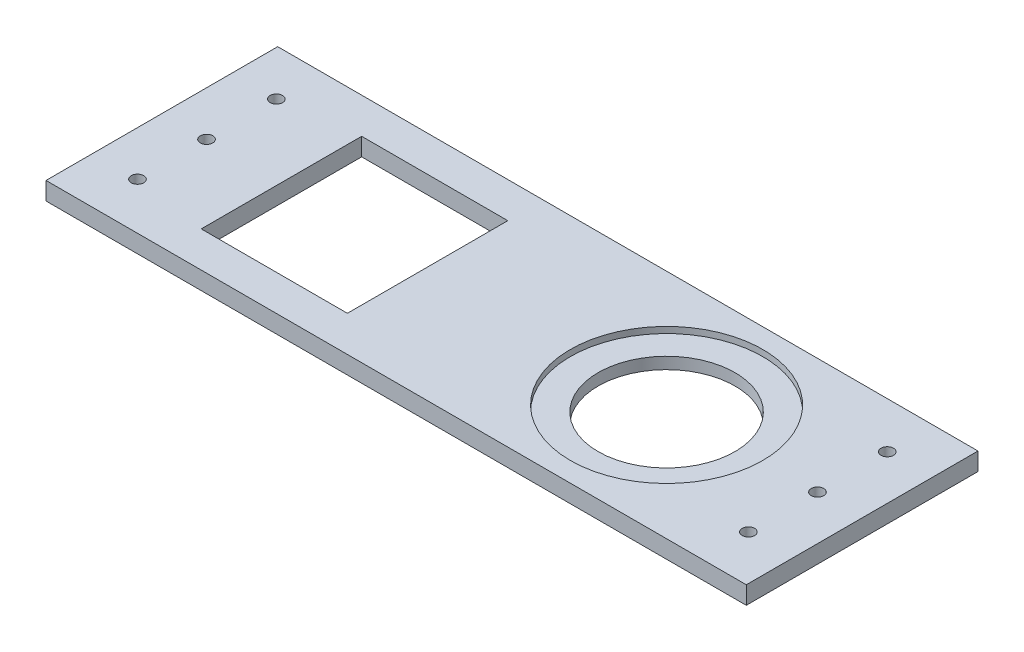
from build123d import *

# Parameters (mm, degrees)
SKETCH2_W               = 196.45
SKETCH2_H               = 151.7
BOSS_EXTRUDE1_DEPTH     = 5
CUT_EXTRUDE2_DEPTH      = 15
CUT_EXTRUDE2_DEPTH_BACK = 22
SKETCH3_R               = 19.2
SKETCH3_W               = 41
SKETCH3_H               = 45
SKETCH4_R               = 26.99
CUT_EXTRUDE3_DEPTH      = 1.74
SKETCH9_W               = 196.45
SKETCH9_H               = 44.2
SKETCH9_H_2             = 42.5
CUT_EXTRUDE7_DEPTH      = 20
SKETCH10_R              = 1.75
CUT_EXTRUDE8_DEPTH      = 71


with BuildPart() as part:
    # Sketch2 → Boss-Extrude1 (new body)
    with BuildSketch(Plane(origin=(0, 0, 0), x_dir=(1, 0, 0), z_dir=(0, 1, 0))):
        with Locations((-1.775, 0.85)):
            Rectangle(SKETCH2_W, SKETCH2_H)
    extrude(amount=BOSS_EXTRUDE1_DEPTH)

    # Sketch3 → Cut-Extrude2 (cut, two sides: drawn at the far end of the back side and taken through both)
    with BuildSketch(Plane(origin=(0, 0, 0), x_dir=(1, 0, 0), z_dir=(0, 1, 0)).offset(-CUT_EXTRUDE2_DEPTH_BACK)):
        with Locations((41.585, 0)):
            Circle(SKETCH3_R)
        with Locations((-45.952707493, 0)):
            Rectangle(SKETCH3_W, SKETCH3_H)
    extrude(amount=CUT_EXTRUDE2_DEPTH + CUT_EXTRUDE2_DEPTH_BACK, mode=Mode.SUBTRACT)

    # Sketch4 → Cut-Extrude3 (cut)
    with BuildSketch(Plane(origin=(0, 5, 0), x_dir=(1, 0, 0), z_dir=(0, 1, 0))):
        with Locations((41.585, 0)):
            Circle(SKETCH4_R)
    extrude(amount=-CUT_EXTRUDE3_DEPTH, mode=Mode.SUBTRACT)

    # Sketch9 → Cut-Extrude7 (cut)
    with BuildSketch(Plane(origin=(0, 5, 0), x_dir=(1, 0, 0), z_dir=(0, 1, 0))):
        with Locations((-1.775, 54.6)):
            Rectangle(SKETCH9_W, SKETCH9_H)
        with Locations((-1.775, -53.75)):
            Rectangle(SKETCH9_W, SKETCH9_H_2)
    extrude(amount=-CUT_EXTRUDE7_DEPTH, mode=Mode.SUBTRACT)

    # Sketch10 → Cut-Extrude8 (cut)
    with BuildSketch(Plane(origin=(-19.622722173, -51.76654099, -93.279928148), x_dir=(1, 0, 0), z_dir=(0, 1, 0))):
        with Locations((-67.844805312, -93.279928148)):
            Circle(SKETCH10_R)
        with Locations((-67.844805312, -112.647304941)):
            Circle(SKETCH10_R)
        with Locations((-67.844805312, -73.696156084)):
            Circle(SKETCH10_R)
        with Locations((103.540249658, -73.696156084)):
            Circle(SKETCH10_R)
        with Locations((103.540249658, -93.279928148)):
            Circle(SKETCH10_R)
        with Locations((103.540249658, -112.647304941)):
            Circle(SKETCH10_R)
    extrude(amount=CUT_EXTRUDE8_DEPTH, mode=Mode.SUBTRACT)


solid = part.part
